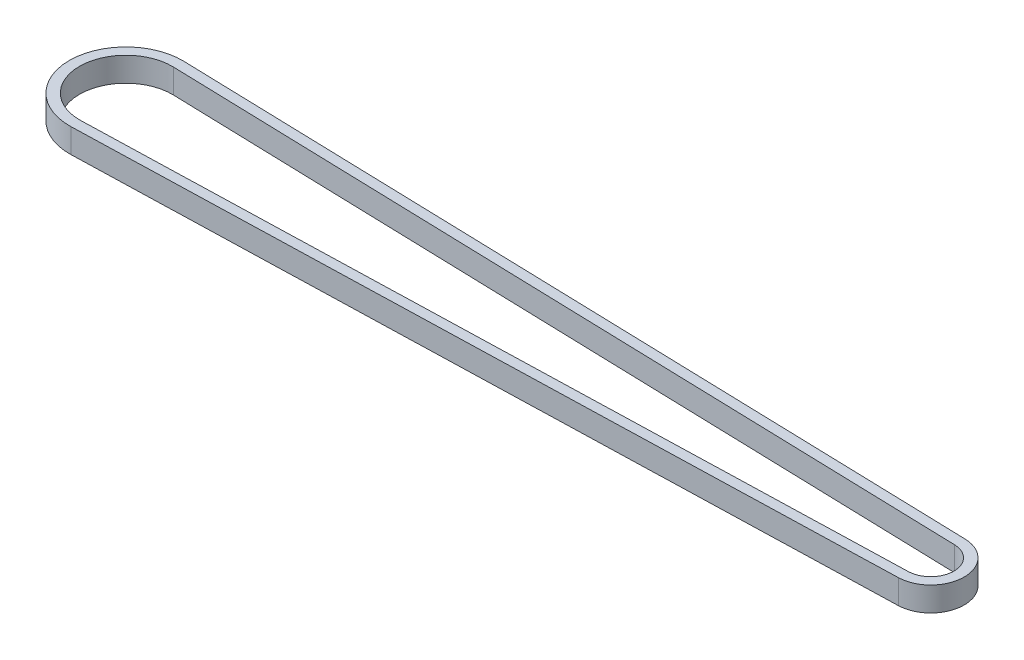
from build123d import *

# Parameters (mm, degrees)
BOSS_EXTRUDE1_DEPTH = 5.9944


with BuildPart() as part:
    # Sketch1 → Boss-Extrude1 (new body)
    with BuildSketch(Plane(origin=(0, 0, 0), x_dir=(1, 0, 0), z_dir=(0, 1, 0))):
        with BuildLine():
            Line((-99.039563218, 13.964231039), (99.678212644, 8.251591068))
            ThreePointArc((99.678212644, 8.251591068), (107.696, 0), (99.678212644, -8.251591068))
            Line((99.678212644, -8.251591068), (-99.039563218, -13.964231039))
            ThreePointArc((-99.039563218, -13.964231039), (-113.411, 0), (-99.039563218, 13.964231039))
        make_face()
        with BuildLine():
            Line((-99.111163483, 11.450650507), (99.605954826, 5.726594727))
            ThreePointArc((99.605954826, 5.726594727), (105.16997, 0), (99.605954826, -5.726594727))
            Line((99.605954826, -5.726594727), (-99.111163483, -11.450650507))
            ThreePointArc((-99.111163483, -11.450650507), (-110.8964, 0), (-99.111163483, 11.450650507))
        make_face(mode=Mode.SUBTRACT)
    extrude(amount=BOSS_EXTRUDE1_DEPTH)


solid = part.part
